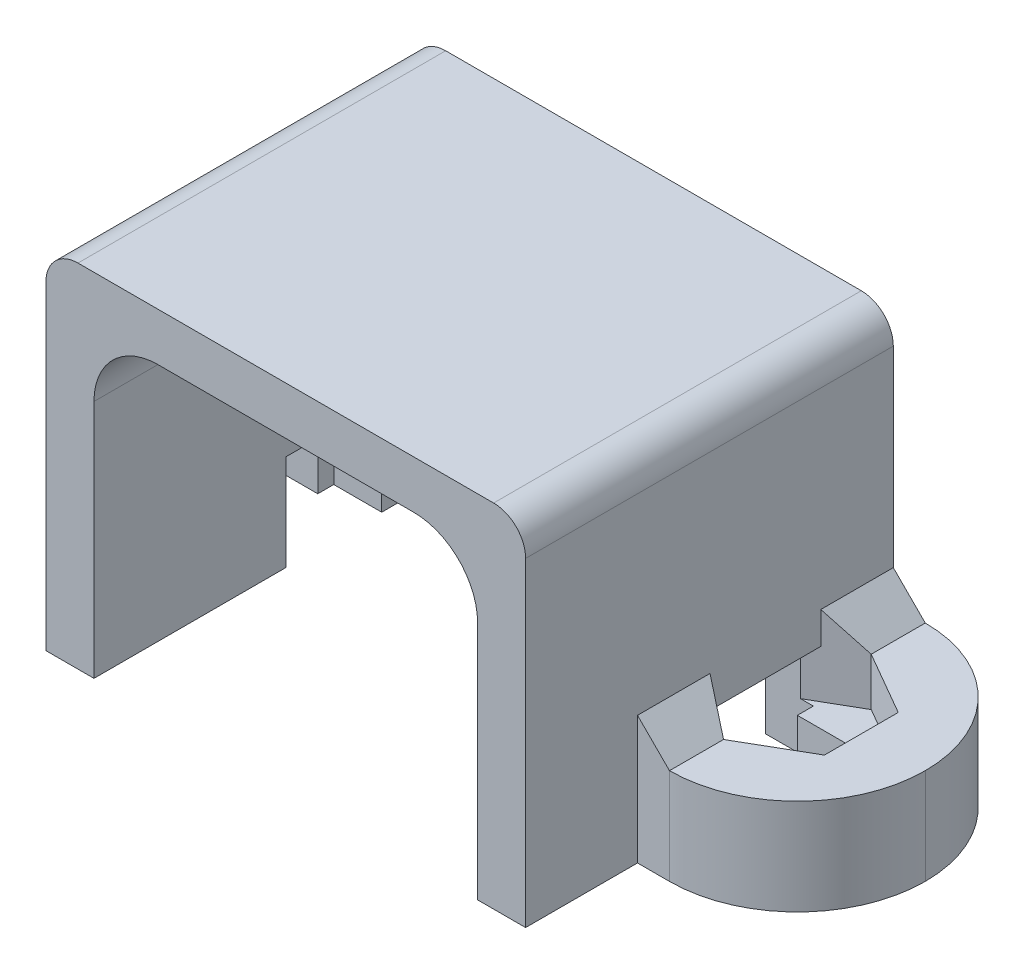
from build123d import *

# Parameters (mm, degrees)
SKETCH_1_W          = 15
SKETCH_1_H          = 11
EXTRUDE_1_DEPTH     = 11.5
SKETCH_2_W          = 5
SKETCH_2_H          = 8
EXTRUDE_2_DEPTH     = 3
SKETCH_3_W          = 12
SKETCH_3_H          = 9.5
CUT_EXTRUDE_1_DEPTH = 21.236106345
CUT_EXTRUDE_2_DEPTH = 1.5
SKETCH_5_W          = 1.5
SKETCH_5_H          = 3
CUT_EXTRUDE_3_DEPTH = 3
SKETCH_6_W          = 2.5
SKETCH_6_H          = 2
CUT_EXTRUDE_4_DEPTH = 1.5
FILLET_1_R          = 2
FILLET_2_R          = 4
FILLET_3_R          = 1
CHAMFER_1_SIZE      = 1
FILLET_4_R          = 1


with BuildPart() as part:
    # 草图1 → 凸台-拉伸1 (new body)
    with BuildSketch(Plane.XY):
        with Locations((0, 5.5)):
            Rectangle(SKETCH_1_W, SKETCH_1_H)
    extrude(amount=EXTRUDE_1_DEPTH)

    # 草图2 → 凸台-拉伸2 (add)
    with BuildSketch(Plane.XZ):
        with Locations((-10, 4)):
            Rectangle(SKETCH_2_W, SKETCH_2_H)
        with Locations((10, 4)):
            Rectangle(SKETCH_2_W, SKETCH_2_H)
    extrude(amount=-EXTRUDE_2_DEPTH)

    # 草图3 → 切除-拉伸1 (cut, through all)
    with BuildSketch(Plane(origin=(0, 0, 0), x_dir=(-1, 0, 0), z_dir=(0, 0, -1))):
        with Locations((0, 4.75)):
            Rectangle(SKETCH_3_W, SKETCH_3_H)
    extrude(amount=-CUT_EXTRUDE_1_DEPTH, mode=Mode.SUBTRACT)

    # 草图4 → 切除-拉伸2 (cut)
    with BuildSketch(Plane(origin=(0, 3, 0), x_dir=(1, 0, 0), z_dir=(0, 1, 0))):
        Polygon((8.5, -1.690598923), (6.5, -2.845299462), (6.5, -5.154700538), (8.5, -6.309401077), (10.5, -5.154700538), (10.5, -2.845299462), align=None)
        Polygon((-10.5, -2.845299462), (-8.5, -1.690598923), (-6.5, -2.845299462), (-6.5, -5.154700538), (-8.5, -6.309401077), (-10.5, -5.154700538), align=None)
    extrude(amount=-CUT_EXTRUDE_2_DEPTH, mode=Mode.SUBTRACT)

    # 草图5 → 切除-拉伸3 (cut)
    with BuildSketch(Plane.XZ):
        with Locations((6.75, 4)):
            Rectangle(SKETCH_5_W, SKETCH_5_H)
        with Locations((-6.75, 4)):
            Rectangle(SKETCH_5_W, SKETCH_5_H)
    extrude(amount=-CUT_EXTRUDE_3_DEPTH, mode=Mode.SUBTRACT)

    # 草图6 → 切除-拉伸4 (cut)
    with BuildSketch(Plane.XZ):
        with Locations((8.75, 4)):
            Rectangle(SKETCH_6_W, SKETCH_6_H)
        with Locations((-8.75, 4)):
            Rectangle(SKETCH_6_W, SKETCH_6_H)
    extrude(amount=-CUT_EXTRUDE_4_DEPTH, mode=Mode.SUBTRACT)

    # 圆角1
    fillet_1_edges = [part.edges().sort_by_distance(p)[0] for p in [
        (6, 9.5, 5.75),
        (-6, 9.5, 5.75),
    ]]
    fillet(fillet_1_edges, radius=FILLET_1_R)

    # 圆角2
    fillet_2_edges = [part.edges().sort_by_distance(p)[0] for p in [
        (12.5, 1.5, 0),
        (12.5, 1.5, 8),
        (-12.5, 1.5, 0),
        (-12.5, 1.5, 8),
    ]]
    fillet(fillet_2_edges, radius=FILLET_2_R - 0.0001)  # a hair under: the kernel refuses the full size

    # 圆角3
    fillet_3_edges = [part.edges().sort_by_distance(p)[0] for p in [
        (10, 0.75, 5),
        (10, 0.75, 3),
        (-10, 0.75, 3),
        (-10, 0.75, 5),
    ]]
    fillet(fillet_3_edges, radius=FILLET_3_R - 0.0001)  # a hair under: the kernel refuses the full size

    # 倒角1
    chamfer_1_edges = [part.edges().sort_by_distance(p)[0] for p in [
        (7.5, 3, 6.866025404),
        (7.5, 3, 1.133974596),
        (-7.5, 3, 6.866025404),
        (-7.5, 3, 1.133974596),
    ]]
    chamfer(chamfer_1_edges, length=CHAMFER_1_SIZE)

    # 圆角4
    fillet_4_edges = [part.edges().sort_by_distance(p)[0] for p in [
        (-7.5, 11, 5.75),
        (7.5, 11, 5.75),
    ]]
    fillet(fillet_4_edges, radius=FILLET_4_R)


solid = part.part
